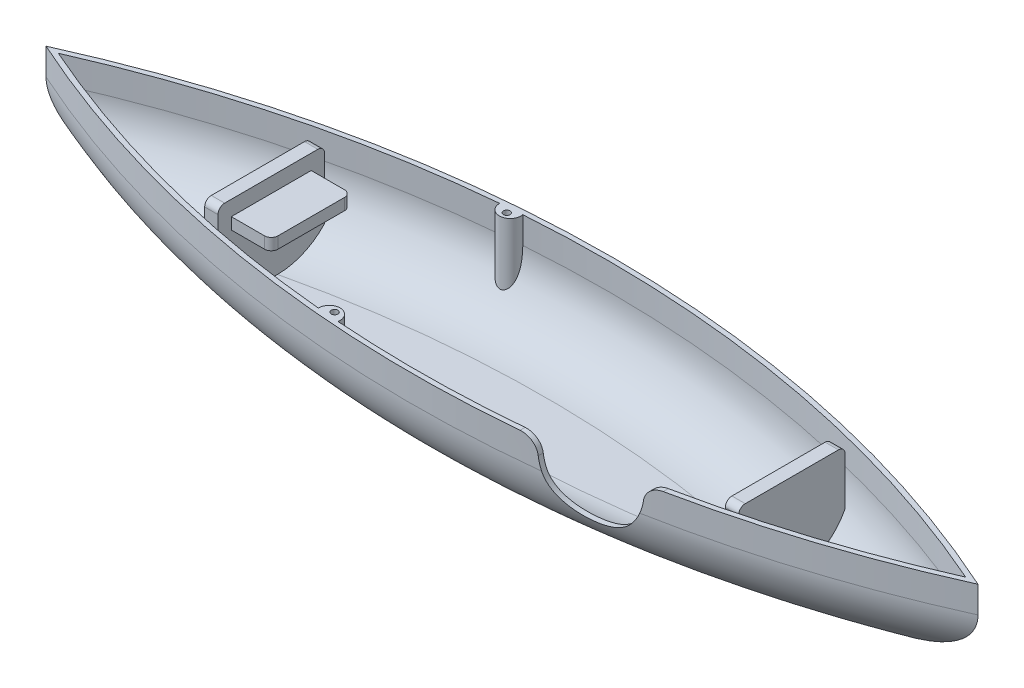
from build123d import *

# Parameters (mm, degrees)
BOSS_EXTRUDE1_DEPTH = 14
FILLET1_R           = 10
SHELL1_T            = -0.75
BOSS_EXTRUDE3_REACH = 144.42
SKETCH3_W           = 2
SKETCH3_H           = 16
BOSS_EXTRUDE4_REACH = 144.42
SKETCH4_W           = 2
SKETCH4_H           = 16
SKETCH7_W           = 6
SKETCH7_H           = 1.738824113
SKETCH7_W_2         = 1
BOSS_EXTRUDE5_DEPTH = 6
BOSS_EXTRUDE6_REACH = 144.42
SKETCH2_R           = 0.5
CUT_EXTRUDE1_DEPTH  = 75.886027208
FILLET2_R           = 2.5
FILLET3_R           = 1


with BuildPart() as part:
    # Sketch1 → Boss-Extrude1 (new body)
    with BuildSketch(Plane(origin=(0, 0, 0), x_dir=(1, 0, 0), z_dir=(0, 1, 0))):
        with BuildLine():
            ThreePointArc((-140, 7), (-70, 22.080666152), (0, 7))
            ThreePointArc((0, 7), (-70, -8.080666152), (-140, 7))
        make_face()
    extrude(amount=BOSS_EXTRUDE1_DEPTH)

    # Fillet1
    fillet1_edges = [part.edges().sort_by_distance(p)[0] for p in [
        (-70, 0, -22.080666152),
        (-70, 0, 8.080666152),
    ]]
    fillet(fillet1_edges, radius=FILLET1_R)

    # Shell1
    shell1_openings = [part.faces().sort_by_distance(p)[0] for p in [
        (-70, 14, -7),
    ]]
    offset(amount=SHELL1_T, openings=shell1_openings)

    # Sketch3 → Boss-Extrude3 (add, up to next)
    with BuildSketch(Plane(origin=(0, 14, 0), x_dir=(1, 0, 0), z_dir=(0, 1, 0)), mode=Mode.PRIVATE) as boss_extrude3_sk1:
        with Locations((-28.963300867, 7)):
            Rectangle(SKETCH3_W, SKETCH3_H)
    boss_extrude3_tool1 = extrude(boss_extrude3_sk1.sketch, amount=-BOSS_EXTRUDE3_REACH, mode=Mode.PRIVATE) - part.part
    add(boss_extrude3_tool1.solids().sort_by_distance((-28.963301, 14, -7))[0])

    # Sketch4 → Boss-Extrude4 (add, up to next)
    with BuildSketch(Plane(origin=(0, 14, 0), x_dir=(1, 0, 0), z_dir=(0, 1, 0)), mode=Mode.PRIVATE) as boss_extrude4_sk1:
        with Locations((-107.163300867, 7)):
            Rectangle(SKETCH4_W, SKETCH4_H)
    boss_extrude4_tool1 = extrude(boss_extrude4_sk1.sketch, amount=-BOSS_EXTRUDE4_REACH, mode=Mode.PRIVATE) - part.part
    add(boss_extrude4_tool1.solids().sort_by_distance((-107.163301, 14, -7))[0])

    # Sketch7 → Boss-Extrude5 (add, symmetric)
    with BuildSketch(Plane(origin=(-68.063300867, 14.338824113, -7), x_dir=(1, 0, 0), z_dir=(0, 0, 1))):
        with Locations((-35.1, -3.469412057)):
            Rectangle(SKETCH7_W, SKETCH7_H)
        with Locations((37.6, -3.469412057)):
            Rectangle(SKETCH7_W_2, SKETCH7_H)
    extrude(amount=BOSS_EXTRUDE5_DEPTH, both=True)

    # Sketch2 → Boss-Extrude6 (add, up to next)
    with BuildSketch(Plane(origin=(0, 14, 0), x_dir=(1, 0, 0), z_dir=(0, 1, 0)), mode=Mode.PRIVATE) as boss_extrude6_sk1:
        with BuildLine():
            ThreePointArc((-85.473707865, 20.621838762), (-83.868839724, 20.761482443), (-82.262715156, 20.885844736))
            ThreePointArc((-82.262715156, 20.885844736), (-83.721465474, 18.969031937), (-85.473707865, 20.621838762))
        make_face()
        with Locations(Location((-83.725214676, 19.927882441, 0), (0, 0, 244.404071231))):
            Circle(SKETCH2_R, mode=Mode.SUBTRACT)
    boss_extrude6_tool1 = extrude(boss_extrude6_sk1.sketch, amount=-BOSS_EXTRUDE6_REACH, mode=Mode.PRIVATE) - part.part
    # Sketch2 → Boss-Extrude6 (add, up to next)
    with BuildSketch(Plane(origin=(0, 14, 0), x_dir=(1, 0, 0), z_dir=(0, 1, 0)), mode=Mode.PRIVATE) as boss_extrude6_sk2:
        with BuildLine():
            ThreePointArc((-85.473707865, -6.621838762), (-83.721465474, -4.969031937), (-82.262715156, -6.885844736))
            ThreePointArc((-82.262715156, -6.885844736), (-83.868839724, -6.761482443), (-85.473707865, -6.621838762))
        make_face()
        with Locations(Location((-83.725214676, -5.927882441, 0), (0, 0, 270))):
            Circle(SKETCH2_R, mode=Mode.SUBTRACT)
    boss_extrude6_tool2 = extrude(boss_extrude6_sk2.sketch, amount=-BOSS_EXTRUDE6_REACH, mode=Mode.PRIVATE) - part.part
    add(boss_extrude6_tool1.solids().sort_by_distance((-83.724552, 14, -19.006578))[0])
    add(boss_extrude6_tool2.solids().sort_by_distance((-83.724552, 14, 5.006578))[0])

    # Sketch8 → Cut-Extrude1 (cut, through all)
    with BuildSketch(Plane(origin=(-68.063300867, 14.338824113, -7), x_dir=(1, 0, 0), z_dir=(0, 0, 1))):
        with BuildLine():
            Line((16.070157569, -1.723579336), (16.070157569, -0.338824113))
            Line((16.070157569, -0.338824113), (29.930157569, -0.338824113))
            Line((29.930157569, -0.338824113), (29.930157569, -1.723579336))
            ThreePointArc((29.930157569, -1.723579336), (23.000157569, -8.653579336), (16.070157569, -1.723579336))
        make_face()
    extrude(amount=CUT_EXTRUDE1_DEPTH, mode=Mode.SUBTRACT)

    # Fillet2
    # the kernel refuses this fillet: 2.5 mm, written as the material it takes off along each edge
    with BuildSketch(Plane(origin=(-38.133143298, 14, -1.780943908), x_dir=(1, 0, 0), z_dir=(0, 0, 1))) as fillet2_piece_1:
        with BuildLine():
            CenterArc((2.433820219, -2.5), FILLET2_R, 90, 83.20798298)
            Line((-0.04863477, -2.204335955), (-0.296880269, -2.174769551))
            ThreePointArc((-0.296880269, -2.174769551), (-0.25, -1.384755222), (-0.25, 0))
            Line((-0.25, 0), (0, 0.25))
            Line((0, 0.25), (2.433820219, 0.25))
            Line((2.433820219, 0.25), (2.433820219, 0))
        make_face()
    extrude(amount=12.932697321, mode=Mode.SUBTRACT)
    with BuildSketch(Plane(origin=(-51.993143298, 14, 0.285496172), x_dir=(-1, 0, 0), z_dir=(0, 0, 1))) as fillet2_piece_2:
        with BuildLine():
            CenterArc((2.433820219, 2.5), FILLET2_R, 186.79201702, 83.20798298)
            Line((-0.04863477, 2.204335955), (-0.296880269, 2.174769551))
            ThreePointArc((-0.296880269, 2.174769551), (-0.25, 1.384755222), (-0.25, 0))
            Line((-0.25, 0), (0, -0.25))
            Line((0, -0.25), (2.433820219, -0.25))
            Line((2.433820219, -0.25), (2.433820219, 0))
        make_face()
    extrude(amount=12.92336315, mode=Mode.SUBTRACT)

    # Fillet3
    fillet3_edges = [part.edges().sort_by_distance(p)[0] for p in [
        (-28.963300867, 14, -15),
        (-28.963300867, 14, 1),
        (-107.163300867, 14, 1),
        (-107.163300867, 14, -15),
        (-100.163300867, 10.869412057, -13),
        (-100.163300867, 10.869412057, -1),
    ]]
    fillet(fillet3_edges, radius=FILLET3_R)


solid = part.part
